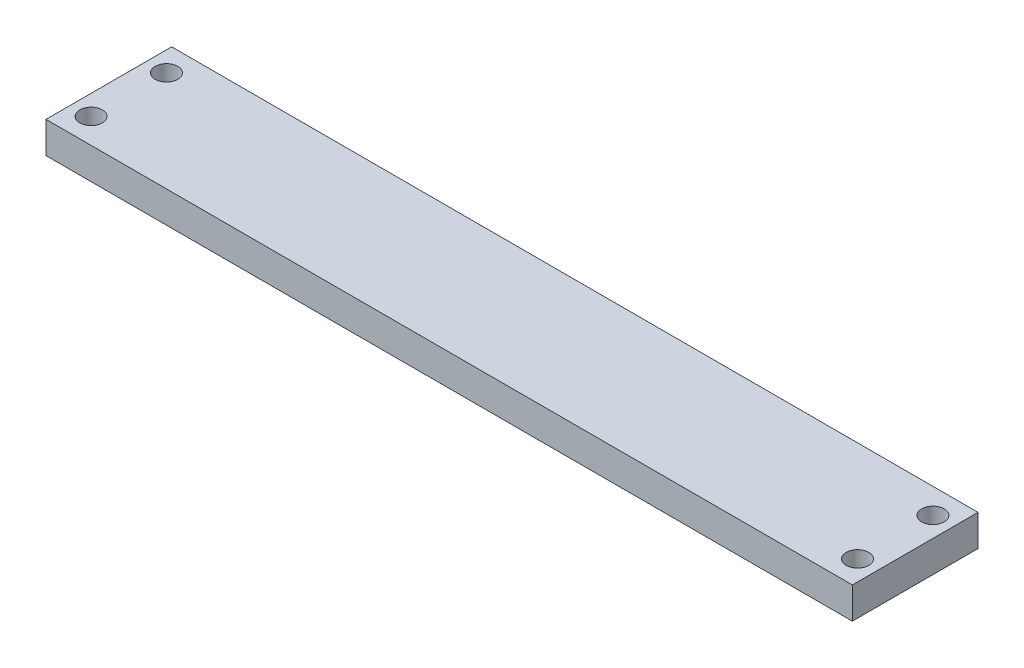
from build123d import *

# Parameters (mm, degrees)
SKETCH2_W            = 128.35
SKETCH2_H            = 20
BOSS_EXTRUDE1_DEPTH  = 5
M3_CLEARANCE_HOLE1_D = 3.6


with BuildPart() as part:
    # Sketch2 → Boss-Extrude1 (new body)
    with BuildSketch(Plane(origin=(0, 0, 0), x_dir=(1, 0, 0), z_dir=(0, 1, 0))):
        with Locations((24.337601626, 10.975609756)):
            Rectangle(SKETCH2_W, SKETCH2_H)
    extrude(amount=BOSS_EXTRUDE1_DEPTH)

    # M3 Clearance Hole1 (through all)
    with Locations(Plane(origin=(0, 5, 0), x_dir=(1, 0, 0), z_dir=(0, 1, 0))):
        with Locations((-36.662398374, 16.975609756), (-36.662398374, 4.975609756), (85.337601626, 16.975609756), (85.337601626, 4.975609756)):
            Hole(M3_CLEARANCE_HOLE1_D / 2)


solid = part.part
